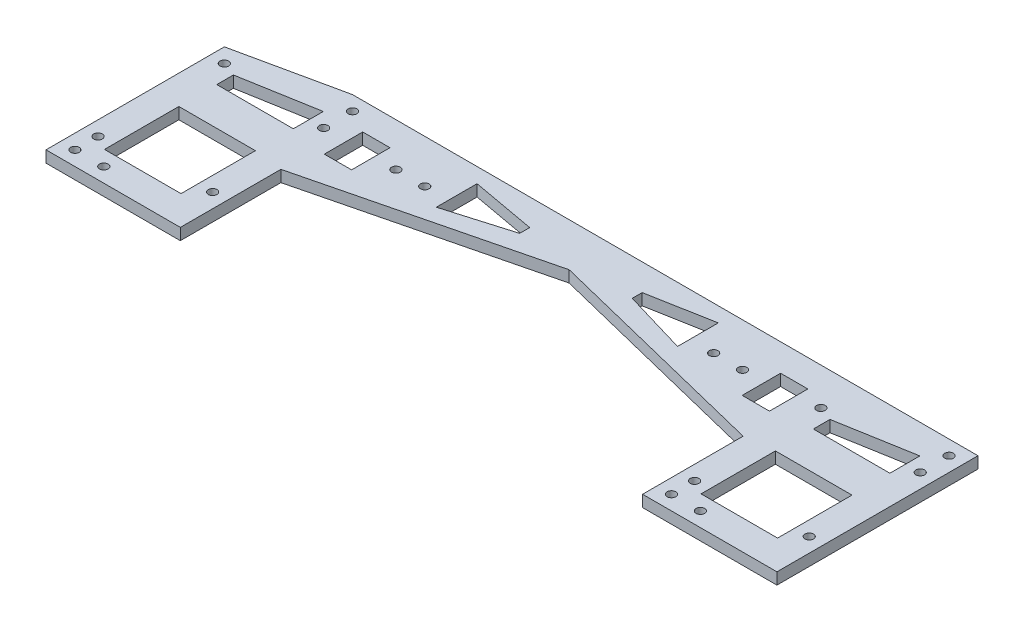
from build123d import *

# Parameters (mm, degrees)
SKETCH1_R           = 1.5
BOSS_EXTRUDE1_DEPTH = 3
SKETCH2_W           = 26.5
SKETCH2_H           = 13.12704922
BOSS_EXTRUDE2_DEPTH = 3
SKETCH3_R           = 1.5
CUT_EXTRUDE1_DEPTH  = 10
SKETCH4_R           = 1.5
CUT_EXTRUDE2_DEPTH  = 10
BOSS_EXTRUDE4_START = -4
SKETCH6_R           = 1.5
SKETCH6_W           = 26.5
SKETCH6_H           = 25.74798773
BOSS_EXTRUDE4_DEPTH = 4
SKETCH9_R           = 1.5
CUT_EXTRUDE3_DEPTH  = 6
CUT_EXTRUDE4_DEPTH  = 14
SKETCH11_R          = 1.5
CUT_EXTRUDE5_DEPTH  = 14
SKETCH12_W          = 9.439157555
SKETCH12_H          = 13.291874924
CUT_EXTRUDE6_DEPTH  = 10


with BuildPart() as part:
    # Sketch1 → Boss-Extrude1 (new body)
    with BuildSketch(Plane(origin=(0, 0, 0), x_dir=(1, 0, 0), z_dir=(0, 1, 0))):
        Polygon((-5, -5), (41.5, -5), (41.5, 64.6), (31.5, 64.6), (-5, 56.73), align=None)
        Polygon((5, 5.234024539), (5, 56.73), (31.5, 54.48), (31.5, 5.234024539), align=None, mode=Mode.SUBTRACT)
        Circle(SKETCH1_R, mode=Mode.SUBTRACT)
        with Locations((0, 51.73)):
            Circle(SKETCH1_R, mode=Mode.SUBTRACT)
        with Locations((36.5, 49.6)):
            Circle(SKETCH1_R, mode=Mode.SUBTRACT)
        with Locations((36.5, 59.6)):
            Circle(SKETCH1_R, mode=Mode.SUBTRACT)
        with Locations((36.5, 11.18)):
            Circle(SKETCH1_R, mode=Mode.SUBTRACT)
    extrude(amount=BOSS_EXTRUDE1_DEPTH)

    # Sketch2 → Boss-Extrude2 (add)
    with BuildSketch(Plane(origin=(0, 3, 0), x_dir=(1, 0, 0), z_dir=(0, 1, 0))):
        with Locations((18.25, 37.545536879)):
            Rectangle(SKETCH2_W, SKETCH2_H)
        Polygon((5, 56.73), (5, 49.867078553), (31.5, 54.48), align=None)
    extrude(amount=-BOSS_EXTRUDE2_DEPTH)

    # Sketch3 → Cut-Extrude1 (cut)
    with BuildSketch(Plane(origin=(0, 3, 0), x_dir=(1, 0, 0), z_dir=(0, 1, 0))):
        with Locations((10, 0)):
            Circle(SKETCH3_R)
    extrude(amount=-CUT_EXTRUDE1_DEPTH, mode=Mode.SUBTRACT)

    # Sketch4 → Cut-Extrude2 (cut)
    with BuildSketch(Plane(origin=(0, 3, 0), x_dir=(1, 0, 0), z_dir=(0, 1, 0))):
        with Locations((0, 8)):
            Circle(SKETCH4_R)
    extrude(amount=-CUT_EXTRUDE2_DEPTH, mode=Mode.SUBTRACT)

    # Sketch6 → Boss-Extrude4 (add)
    with BuildSketch(Plane(origin=(0, 3, 0), x_dir=(1, 0, 0), z_dir=(0, 1, 0)).offset(BOSS_EXTRUDE4_START)):
        Polygon((31.5, 64.6), (-5, 56.73), (-5, -5), (41.5, -5), (41.5, 29.8), (121.5, 49.6), (201.5, 29.8), (201.5, -5), (248, -5), (248, 64.6), align=None)
        Circle(SKETCH6_R, mode=Mode.SUBTRACT)
        with Locations((10, 0)):
            Circle(SKETCH6_R, mode=Mode.SUBTRACT)
        with Locations((0, 8)):
            Circle(SKETCH6_R, mode=Mode.SUBTRACT)
        with Locations((36.5, 11.18)):
            Circle(SKETCH6_R, mode=Mode.SUBTRACT)
        with Locations((18.25, 18.108018404)):
            Rectangle(SKETCH6_W, SKETCH6_H, mode=Mode.SUBTRACT)
        Polygon((31.5, 44.109061489), (5, 44.109061489), (5, 49.867078553), (31.5, 54.48), align=None, mode=Mode.SUBTRACT)
        with Locations((0, 51.73)):
            Circle(SKETCH6_R, mode=Mode.SUBTRACT)
        with Locations((36.5, 49.6)):
            Circle(SKETCH6_R, mode=Mode.SUBTRACT)
        with Locations((36.5, 59.6)):
            Circle(SKETCH6_R, mode=Mode.SUBTRACT)
        with Locations((243, 49.6)):
            Circle(SKETCH6_R, mode=Mode.SUBTRACT)
        with Locations((243, 59.6)):
            Circle(SKETCH6_R, mode=Mode.SUBTRACT)
        with Locations((206.5, 0)):
            Circle(SKETCH6_R, mode=Mode.SUBTRACT)
        with Locations((216.5, 0)):
            Circle(SKETCH6_R, mode=Mode.SUBTRACT)
        with Locations((206.5, 8)):
            Circle(SKETCH6_R, mode=Mode.SUBTRACT)
        with Locations((243, 11.18)):
            Circle(SKETCH6_R, mode=Mode.SUBTRACT)
        with Locations((224.75, 18.108018404)):
            Rectangle(SKETCH6_W, SKETCH6_H, mode=Mode.SUBTRACT)
        with Locations((206.5, 51.73)):
            Circle(SKETCH6_R, mode=Mode.SUBTRACT)
        Polygon((238, 44.109061489), (211.5, 44.109061489), (211.5, 49.867078553), (238, 54.48), align=None, mode=Mode.SUBTRACT)
    extrude(amount=BOSS_EXTRUDE4_DEPTH)

    # Sketch9 → Cut-Extrude3 (cut)
    with BuildSketch(Plane(origin=(0, 3, 0), x_dir=(1, 0, 0), z_dir=(0, 1, 0))):
        with Locations((61.5, 49.6)):
            Circle(SKETCH9_R)
        with Locations((181.5, 49.6)):
            Circle(SKETCH9_R)
    extrude(amount=-CUT_EXTRUDE3_DEPTH, mode=Mode.SUBTRACT)

    # Sketch10 → Cut-Extrude4 (cut)
    with BuildSketch(Plane(origin=(0, 3, 0), x_dir=(1, 0, 0), z_dir=(0, 1, 0))):
        Polygon((79.758586054, 59.447076053), (79.758586054, 45.354236602), (102.023308671, 51.934500024), (102.023308671, 55.399132807), align=None)
        Polygon((140.976691329, 51.934500024), (140.976691329, 55.399132807), (163.241413946, 59.447076053), (163.241413946, 45.354236602), align=None)
    extrude(amount=-CUT_EXTRUDE4_DEPTH, mode=Mode.SUBTRACT)

    # Sketch11 → Cut-Extrude5 (cut)
    with BuildSketch(Plane(origin=(0, 3, 0), x_dir=(1, 0, 0), z_dir=(0, 1, 0))):
        with Locations((71.5, 49.6)):
            Circle(SKETCH11_R)
        with Locations((171.5, 49.6)):
            Circle(SKETCH11_R)
    extrude(amount=-CUT_EXTRUDE5_DEPTH, mode=Mode.SUBTRACT)

    # Sketch12 → Cut-Extrude6 (cut)
    with BuildSketch(Plane(origin=(0, 3, 0), x_dir=(1, 0, 0), z_dir=(0, 1, 0))):
        with Locations((193.819806215, 48.516488721)):
            Rectangle(SKETCH12_W, SKETCH12_H)
        with Locations((49.180193786, 48.516488721)):
            Rectangle(SKETCH12_W, SKETCH12_H)
    extrude(amount=-CUT_EXTRUDE6_DEPTH, mode=Mode.SUBTRACT)


solid = part.part
